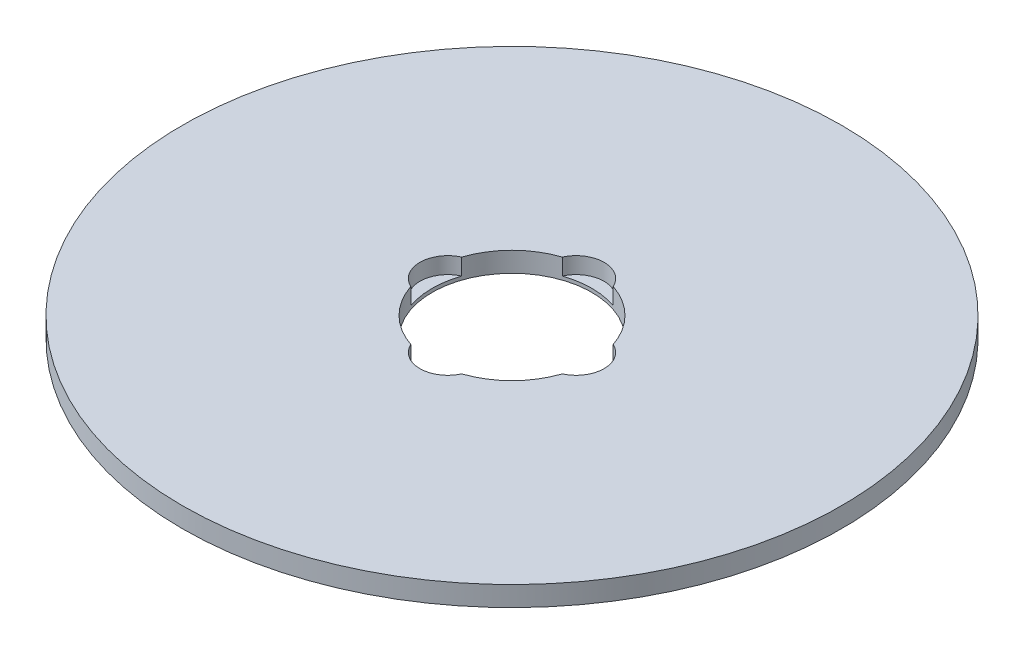
from build123d import *

# Parameters (mm, degrees)
SKETCH1_R           = 82.5
BOSS_EXTRUDE1_DEPTH = 5
SKETCH2_R           = 20
CUT_EXTRUDE1_DEPTH  = 117.779707141
SKETCH3_R           = 7.008114991
CUT_EXTRUDE2_DEPTH  = 4.118421173
CIRPATTERN1_COUNT   = 4


with BuildPart() as part:
    # Sketch1 → Boss-Extrude1 (new body)
    with BuildSketch(Plane(origin=(0, 0, 0), x_dir=(1, 0, 0), z_dir=(0, 1, 0))):
        Circle(SKETCH1_R)
    extrude(amount=BOSS_EXTRUDE1_DEPTH)

    # Sketch2 → Cut-Extrude1 (cut, through all)
    with BuildSketch(Plane(origin=(0, 0, 0), x_dir=(1, 0, 0), z_dir=(0, 1, 0))):
        Circle(SKETCH2_R)
    extrude(amount=CUT_EXTRUDE1_DEPTH, mode=Mode.SUBTRACT)

    # Sketch3 → Cut-Extrude2 (cut)
    with BuildSketch(Plane(origin=(0, 5, 0), x_dir=(1, 0, 0), z_dir=(0, 1, 0))):
        with Locations((-16.044086909, 0)):
            Circle(SKETCH3_R)
    cut_extrude2 = extrude(amount=-CUT_EXTRUDE2_DEPTH, mode=Mode.SUBTRACT)

    # CirPattern1: Cut-Extrude2 ×4 about axis
    cirpattern1_axis = Axis((0, 0, 0), (0, 1, 0))
    for i in range(1, CIRPATTERN1_COUNT):
        add(cut_extrude2.rotate(cirpattern1_axis, i * 360 / CIRPATTERN1_COUNT), mode=Mode.SUBTRACT)


solid = part.part
